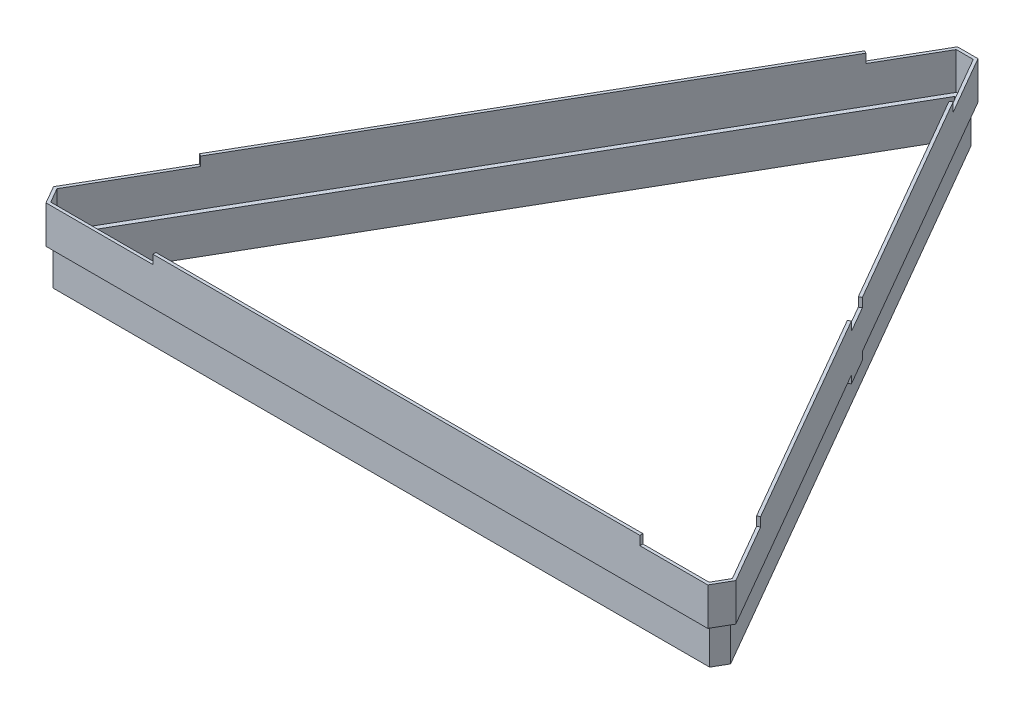
from build123d import *

# Parameters (mm, degrees)
BOSS_EXTRUDE1_DEPTH = 0.2
BOSS_EXTRUDE2_DEPTH = 12.58
SKETCH1_8_W         = 162.49
SKETCH1_8_H         = 1
BOSS_EXTRUDE3_DEPTH = 15.58
BOSS_EXTRUDE4_DEPTH = 12.38
BOSS_EXTRUDE5_DEPTH = 2.58


with BuildPart() as part:
    # Sketch1 → Boss-Extrude1 (new body)
    with BuildSketch(Plane(origin=(0, 0, 0), x_dir=(1, 0, 0), z_dir=(0, 1, 0))):
        Polygon((-113.845299462, 0), (-110.422649731, -5.92820323), (110.422649731, -5.92820323), (113.845299462, 0), (3.422649731, 191.25763964), (-3.422649731, 191.25763964), align=None)
        Polygon((-1.979274058, 188.75763964), (1.979274058, 188.75763964), (110.958548116, 0), (108.979274058, -3.42820323), (-108.979274058, -3.42820323), (-110.958548116, 0), align=None, mode=Mode.SUBTRACT)
    extrude(amount=BOSS_EXTRUDE1_DEPTH)

    # Sketch1<7> → Boss-Extrude2 (add)
    with BuildSketch(Plane(origin=(0, 0, 0), x_dir=(1, 0, 0), z_dir=(0, 1, 0))):
        Polygon((-95.137949192, 30.402081141), (-96.003974596, 30.902081141), (-113.845299462, 0), (-110.422649731, -5.92820323), (-74.74, -5.92820323), (-74.74, -4.92820323), (-109.845299462, -4.92820323), (-112.690598923, 0), align=None)
        Polygon((-3.422649731, 191.25763964), (-14.758974596, 171.622549002), (-13.892949192, 171.122549002), (-2.845299462, 190.25763964), (2.845299462, 190.25763964), (13.892949192, 171.122549002), (14.758974596, 171.622549002), (3.422649731, 191.25763964), align=None)
        Polygon((109.845299462, -4.92820323), (87.75, -4.92820323), (87.75, -5.92820323), (110.422649731, -5.92820323), (113.845299462, 0), (102.508974596, 19.635090638), (101.642949192, 19.135090638), (112.690598923, 0), align=None)
        Polygon((61.133974596, 91.298692801), (56.133974596, 99.958946839), (55.267949192, 99.458946839), (60.267949192, 90.798692801), align=None)
    extrude(amount=BOSS_EXTRUDE2_DEPTH)

    # Sketch1<8> → Boss-Extrude3 (add)
    with BuildSketch(Plane(origin=(0, 0, 0), x_dir=(1, 0, 0), z_dir=(0, 1, 0))):
        Polygon((-14.758974596, 171.622549002), (-96.003974596, 30.902081141), (-95.137949192, 30.402081141), (-13.892949192, 171.122549002), align=None)
        with Locations((6.505, -5.42820323)):
            Rectangle(SKETCH1_8_W, SKETCH1_8_H)
        Polygon((56.133974596, 99.958946839), (14.758974596, 171.622549002), (13.892949192, 171.122549002), (55.267949192, 99.458946839), align=None)
        Polygon((102.508974596, 19.635090638), (61.133974596, 91.298692801), (60.267949192, 90.798692801), (101.642949192, 19.135090638), align=None)
    extrude(amount=BOSS_EXTRUDE3_DEPTH)

    # Sketch1<9> → Boss-Extrude4 (add)
    with BuildSketch(Plane(origin=(0, 0, 0), x_dir=(1, 0, 0), z_dir=(0, 1, 0))):
        Polygon((-112.113248654, 0), (-110.834936491, -2.214101615), (-109.556624327, -4.42820323), (109.556624327, -4.42820323), (112.113248654, 0), (2.556624327, 189.75763964), (-2.556624327, 189.75763964), align=None)
        Polygon((-110.958548116, 0), (-56.468911087, 94.37881982), (-1.979274058, 188.75763964), (1.979274058, 188.75763964), (110.958548116, 0), (108.979274058, -3.42820323), (-108.979274058, -3.42820323), align=None, mode=Mode.SUBTRACT)
    extrude(amount=-BOSS_EXTRUDE4_DEPTH)

    # Sketch1<10> → Boss-Extrude5 (add)
    with BuildSketch(Plane(origin=(0, 0, 0), x_dir=(1, 0, 0), z_dir=(0, 1, 0))):
        Polygon((61.133974596, 91.298692801), (56.133974596, 99.958946839), (55.267949192, 99.458946839), (60.267949192, 90.798692801), align=None)
    extrude(amount=-BOSS_EXTRUDE5_DEPTH)


solid = part.part
